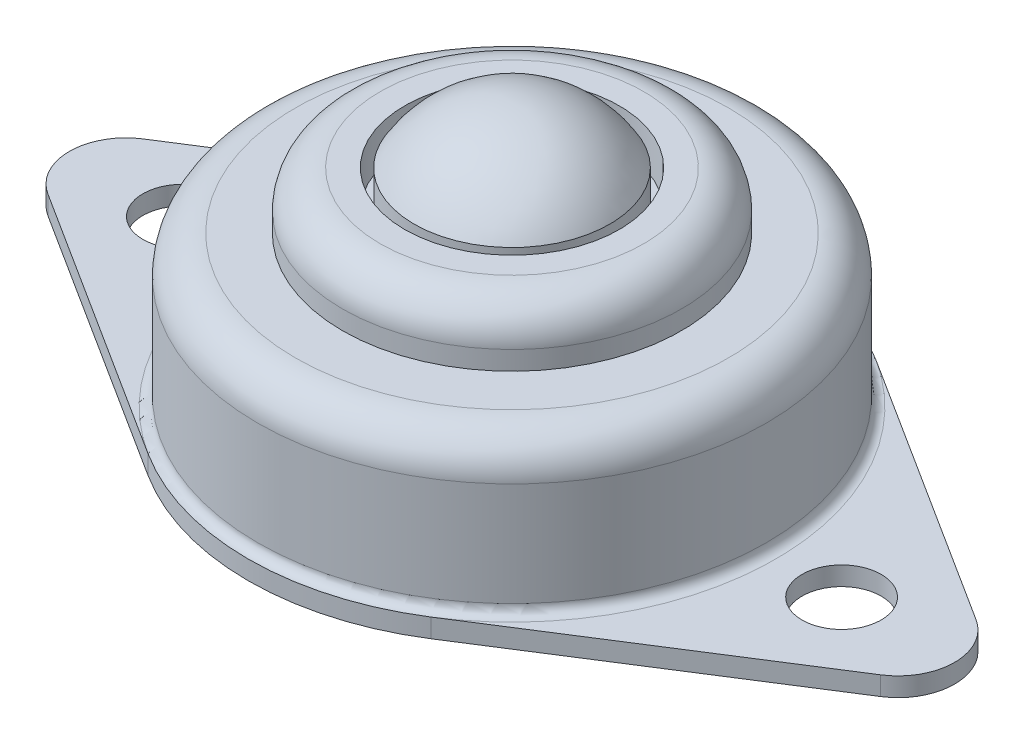
from build123d import *

# Parameters (mm, degrees)
SKETCH_1_R          = 2.1
EXTRUDE_1_DEPTH     = 1
SKETCH_2_R          = 13.5
EXTRUDE_2_DEPTH     = 11
FILLET_1_R          = 0.5
CUT_EXTRUDE_START   = -3
SKETCH_4_R          = 13.5
SKETCH_4_R_2        = 9
CUT_EXTRUDE_1_DEPTH = 3
FILLET_2_R          = 2
SKETCH_5_R          = 5.696152423
SKETCH_5_R_2        = 5.196152423
CUT_EXTRUDE_2_DEPTH = 2


with BuildPart() as part:
    # 草图1 → 凸台-拉伸1 (new body)
    with BuildSketch(Plane(origin=(0, 0, 0), x_dir=(1, 0, 0), z_dir=(0, 1, 0))):
        with BuildLine():
            Line((-22.109756098, 2.531538131), (-7.512195122, 11.813844609))
            ThreePointArc((-7.512195122, 11.813844609), (0, 14), (7.512195122, 11.813844609))
            Line((7.512195122, 11.813844609), (22.109756098, 2.531538131))
            ThreePointArc((22.109756098, 2.531538131), (23.5, 0), (22.109756098, -2.531538131))
            Line((22.109756098, -2.531538131), (7.512195122, -11.813844609))
            ThreePointArc((7.512195122, -11.813844609), (0, -14), (-7.512195122, -11.813844609))
            Line((-7.512195122, -11.813844609), (-22.109756098, -2.531538131))
            ThreePointArc((-22.109756098, -2.531538131), (-23.5, 0), (-22.109756098, 2.531538131))
        make_face()
        with Locations(Location((-17.5, 0, 0), (0, 0, 270))):
            Circle(SKETCH_1_R, mode=Mode.SUBTRACT)
        with Locations(Location((17.5, 0, 0), (0, 0, 90))):
            Circle(SKETCH_1_R, mode=Mode.SUBTRACT)
    extrude(amount=EXTRUDE_1_DEPTH)

    # 草图2 → 凸台-拉伸2 (add)
    with BuildSketch(Plane(origin=(0, 1, 0), x_dir=(1, 0, 0), z_dir=(0, 1, 0))):
        with Locations(Location((0, 0, 0), (0, 0, 270))):
            Circle(SKETCH_2_R)
    extrude(amount=EXTRUDE_2_DEPTH)

    # 圆角1
    fillet_1_edges = [part.edges().sort_by_distance(p)[0] for p in [
        (0, 1, -13.5),
    ]]
    fillet(fillet_1_edges, radius=FILLET_1_R - 0.0001)  # a hair under: the kernel refuses the full size

    # 草图3 → 旋转1 (revolve)
    with BuildSketch(Plane.XY):
        with BuildLine():
            Line((0, 15), (0, 3))
            ThreePointArc((0, 3), (-6, 9), (0, 15))
        make_face()
    revolve(axis=Axis((0, 0.369509774, 0), (0, 1, 0)))

    # 草图4 → 切除-拉伸1 (cut)
    with BuildSketch(Plane(origin=(0, 12, 0), x_dir=(1, 0, 0), z_dir=(0, 1, 0)).offset(CUT_EXTRUDE_START)):
        with Locations(Location((0, 0, 0), (0, 0, 270))):
            Circle(SKETCH_4_R)
        with Locations(Location((0, 0, 0), (0, 0, 270))):
            Circle(SKETCH_4_R_2, mode=Mode.SUBTRACT)
    extrude(amount=CUT_EXTRUDE_1_DEPTH, mode=Mode.SUBTRACT)

    # 圆角2
    fillet_2_edges = [part.edges().sort_by_distance(p)[0] for p in [
        (0, 9, -13.5),
        (0, 12, -9),
    ]]
    fillet(fillet_2_edges, radius=FILLET_2_R)

    # 草图5 → 切除-拉伸2 (cut)
    with BuildSketch(Plane(origin=(0, 12, 0), x_dir=(1, 0, 0), z_dir=(0, 1, 0))):
        with Locations(Location((0, 0, 0), (0, 0, 270))):
            Circle(SKETCH_5_R)
        with Locations(Location((0, 0, 0), (0, 0, 270))):
            Circle(SKETCH_5_R_2, mode=Mode.SUBTRACT)
    extrude(amount=-CUT_EXTRUDE_2_DEPTH, mode=Mode.SUBTRACT)


solid = part.part
